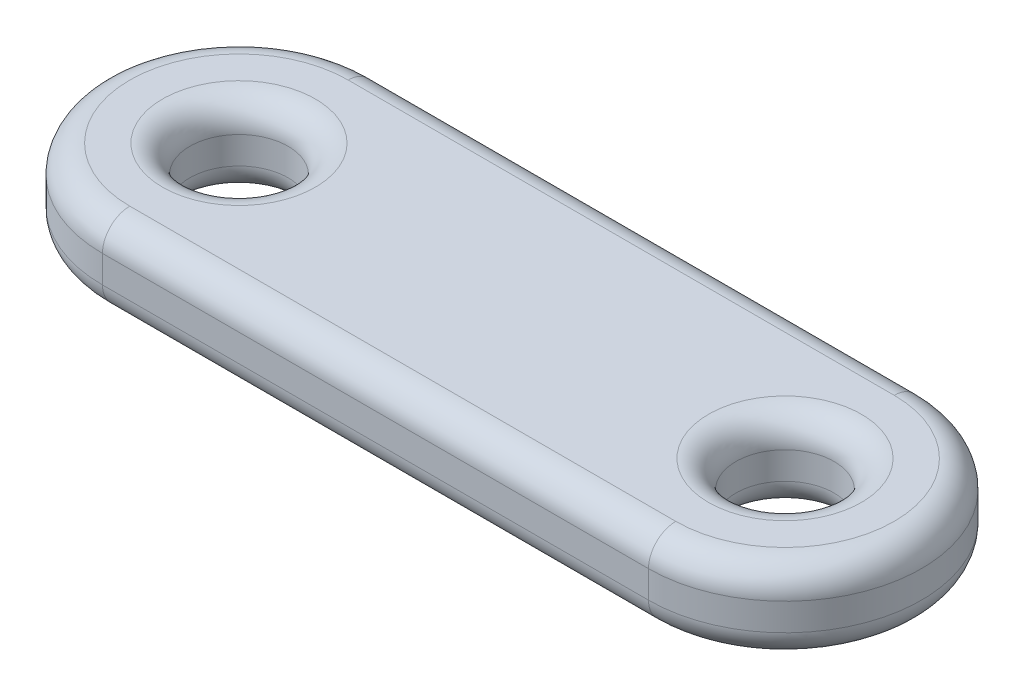
from build123d import *

# Parameters (mm, degrees)
BOSS_EXTRUDE1_DEPTH  = 3
M3_CLEARANCE_HOLE1_D = 3.6
FILLET1_R            = 1


with BuildPart() as part:
    # Sketch1 → Boss-Extrude1 (new body)
    with BuildSketch(Plane(origin=(0, 0, 0), x_dir=(1, 0, 0), z_dir=(0, 1, 0))):
        with BuildLine():
            Line((-10, 5), (10, 5))
            ThreePointArc((10, 5), (15, 0), (10, -5))
            Line((10, -5), (-10, -5))
            ThreePointArc((-10, -5), (-15, 0), (-10, 5))
        make_face()
    extrude(amount=BOSS_EXTRUDE1_DEPTH)

    # M3 Clearance Hole1 (through all)
    with Locations(Plane(origin=(-10, 3, 0), x_dir=(0, 0, 1), z_dir=(0, 1, 0))):
        with Locations((0, 0), (0, 20)):
            Hole(M3_CLEARANCE_HOLE1_D / 2)

    # Fillet1
    fillet1_edges = [part.edges().sort_by_distance(p)[0] for p in [
        (0, 0, 5),
        (15, 0, 0),
        (0, 0, -5),
        (-15, 0, 0),
        (10, 0, 1.8),
        (-10, 0, 1.8),
        (0, 3, -5),
        (15, 3, 0),
        (0, 3, 5),
        (-15, 3, 0),
        (10, 3, 1.8),
        (-10, 3, 1.8),
    ]]
    fillet(fillet1_edges, radius=FILLET1_R)


solid = part.part
